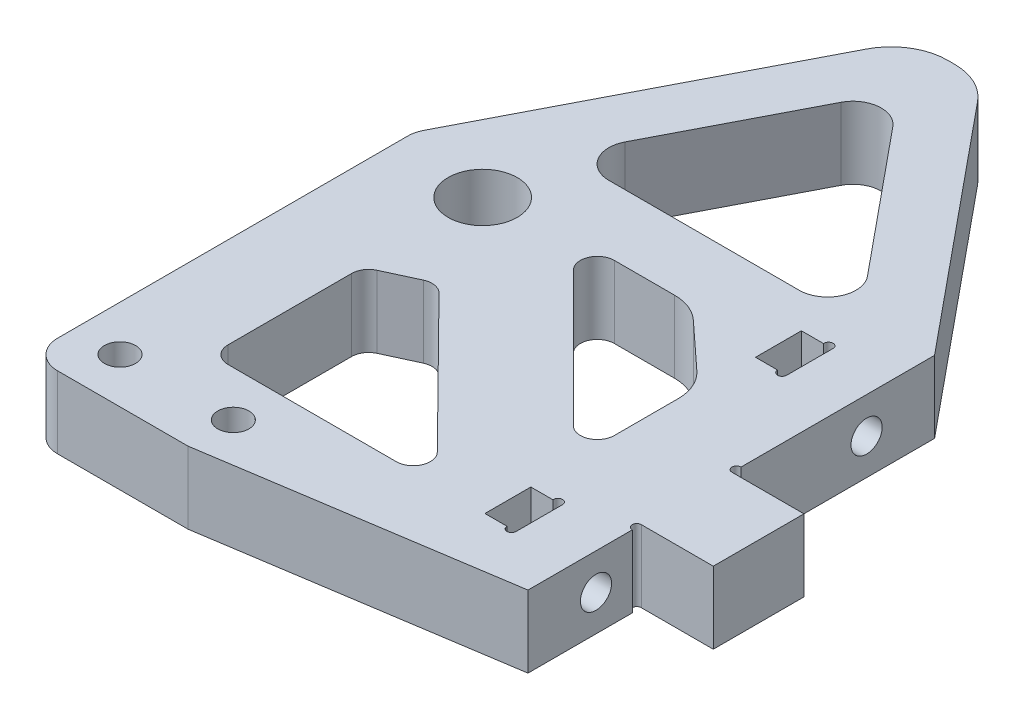
from build123d import *

# Parameters (mm, degrees)
SKETCH1_R           = 6.1
SKETCH1_R_2         = 2.75
BOSS_EXTRUDE1_DEPTH = 12.7
FILLET1_R           = 10
CUT_EXTRUDE1_DEPTH  = 144.126831866
FILLET2_R           = 5
CUT_EXTRUDE2_DEPTH  = 144.126831866
SKETCH6_R           = 2.75
CUT_EXTRUDE3_DEPTH  = 138.787118411
FILLET3_R           = 3
FILLET4_R           = 5


with BuildPart() as part:
    # Sketch1 → Boss-Extrude1 (new body)
    with BuildSketch(Plane(origin=(0, 0, 0), x_dir=(1, 0, 0), z_dir=(0, 1, 0))):
        with BuildLine():
            Line((-80, 0), (-80, 60))
            Line((-80, 60), (-50, 118))
            Line((-50, 118), (-38, 118))
            Line((-38, 118), (0, 71.75))
            Line((0, 71.75), (0, 37.6))
            ThreePointArc((0, 37.6), (-0.8, 36.8), (0, 36))
            Line((0, 36), (12.7, 36))
            Line((12.7, 36), (12.7, 20))
            Line((12.7, 20), (0, 20))
            ThreePointArc((0, 20), (-0.8, 19.2), (0, 18.4))
            Line((0, 18.4), (0, 0))
            Line((0, 0), (-52, -8))
            Line((-52, -8), (-80, -8))
            Line((-80, -8), (-80, 0))
        make_face()
        with Locations((-64, 56)):
            Circle(SKETCH1_R, mode=Mode.SUBTRACT)
        with Locations((-72, 0)):
            Circle(SKETCH1_R_2, mode=Mode.SUBTRACT)
        with Locations((-52, 0)):
            Circle(SKETCH1_R_2, mode=Mode.SUBTRACT)
    extrude(amount=BOSS_EXTRUDE1_DEPTH)

    # Fillet1
    fillet1_edges = [part.edges().sort_by_distance(p)[0] for p in [
        (-38, 6.35, -118),
        (-50, 6.35, -118),
    ]]
    fillet(fillet1_edges, radius=FILLET1_R)

    # Sketch3 → Cut-Extrude1 (cut, through all)
    with BuildSketch(Plane(origin=(0, 12.7, 0), x_dir=(1, 0, 0), z_dir=(0, 1, 0))):
        Polygon((-11.299175731, 69.75), (-43.455065626, 108.887102833), (-63.698394678, 69.75), align=None)
        with BuildLine():
            Line((-29.108244654, 13.108163555), (-54.701743004, 39.020129073))
            Line((-54.701743004, 39.020129073), (-63.944660113, 34.744244414))
            Line((-63.944660113, 34.744244414), (-63.944660113, 8))
            Line((-63.944660113, 8), (-31.242640687, 8))
            ThreePointArc((-31.242640687, 8), (-28.47456458, 9.843386552), (-29.108244654, 13.108163555))
        make_face()
        with BuildLine():
            Line((-42.757359313, 58), (-32.127870675, 58))
            ThreePointArc((-32.127870675, 58), (-29.214746961, 57.450752326), (-26.701629853, 55.878427557))
            Line((-26.701629853, 55.878427557), (-18.573759178, 48.375777703))
            ThreePointArc((-18.573759178, 48.375777703), (-16.671632973, 45.705938108), (-16, 42.497350146))
            Line((-16, 42.497350146), (-16, 31.242640687))
            ThreePointArc((-16, 31.242640687), (-17.851949703, 28.47100209), (-21.121320344, 29.121320344))
            Line((-21.121320344, 29.121320344), (-44.878679656, 52.878679656))
            ThreePointArc((-44.878679656, 52.878679656), (-45.52899791, 56.148050297), (-42.757359313, 58))
        make_face()
    extrude(amount=-CUT_EXTRUDE1_DEPTH, mode=Mode.SUBTRACT)

    # Fillet2
    fillet2_edges = [part.edges().sort_by_distance(p)[0] for p in [
        (-43.455065626, 6.35, -108.887102833),
        (-11.299175731, 6.35, -69.75),
        (-63.698394678, 6.35, -69.75),
    ]]
    fillet(fillet2_edges, radius=FILLET2_R)

    # Sketch4 → Cut-Extrude2 (cut, through all)
    with BuildSketch(Plane(origin=(0, 12.7, 0), x_dir=(1, 0, 0), z_dir=(0, 1, 0))):
        with BuildLine():
            Line((-15.5, 16), (-15.5, 7.9))
            Line((-15.5, 7.9), (-11.6, 7.9))
            ThreePointArc((-11.6, 7.9), (-10.8, 7.1), (-10, 7.9))
            Line((-10, 7.9), (-10, 16.1))
            ThreePointArc((-10, 16.1), (-10.85009833, 16.898429807), (-11.593725393, 16))
            Line((-11.593725393, 16), (-15.5, 16))
        make_face()
        with BuildLine():
            Line((-15.5, 55.65), (-11.6, 55.65))
            ThreePointArc((-11.6, 55.65), (-10.8, 54.85), (-10, 55.65))
            Line((-10, 55.65), (-10, 63.85))
            ThreePointArc((-10, 63.85), (-10.85009833, 64.648429807), (-11.593725393, 63.75))
            Line((-11.593725393, 63.75), (-15.5, 63.75))
            Line((-15.5, 63.75), (-15.5, 55.65))
        make_face()
    extrude(amount=-CUT_EXTRUDE2_DEPTH, mode=Mode.SUBTRACT)

    # Sketch6 → Cut-Extrude3 (cut, through all)
    with BuildSketch(Plane.ZY.offset(10)):
        with Locations((-12, 6.35)):
            Circle(SKETCH6_R)
        with Locations((-59.75, 6.35)):
            Circle(SKETCH6_R)
    extrude(amount=-CUT_EXTRUDE3_DEPTH, mode=Mode.SUBTRACT)

    # Fillet3
    fillet3_edges = [part.edges().sort_by_distance(p)[0] for p in [
        (-54.701743004, 6.35, -39.020129073),
        (-63.944660113, 6.35, -8),
        (-63.944660113, 6.35, -34.744244414),
    ]]
    fillet(fillet3_edges, radius=FILLET3_R)

    # Fillet4
    fillet4_edges = [part.edges().sort_by_distance(p)[0] for p in [
        (-80, 6.35, 8),
        (-80, 6.35, -60),
    ]]
    fillet(fillet4_edges, radius=FILLET4_R)


solid = part.part
